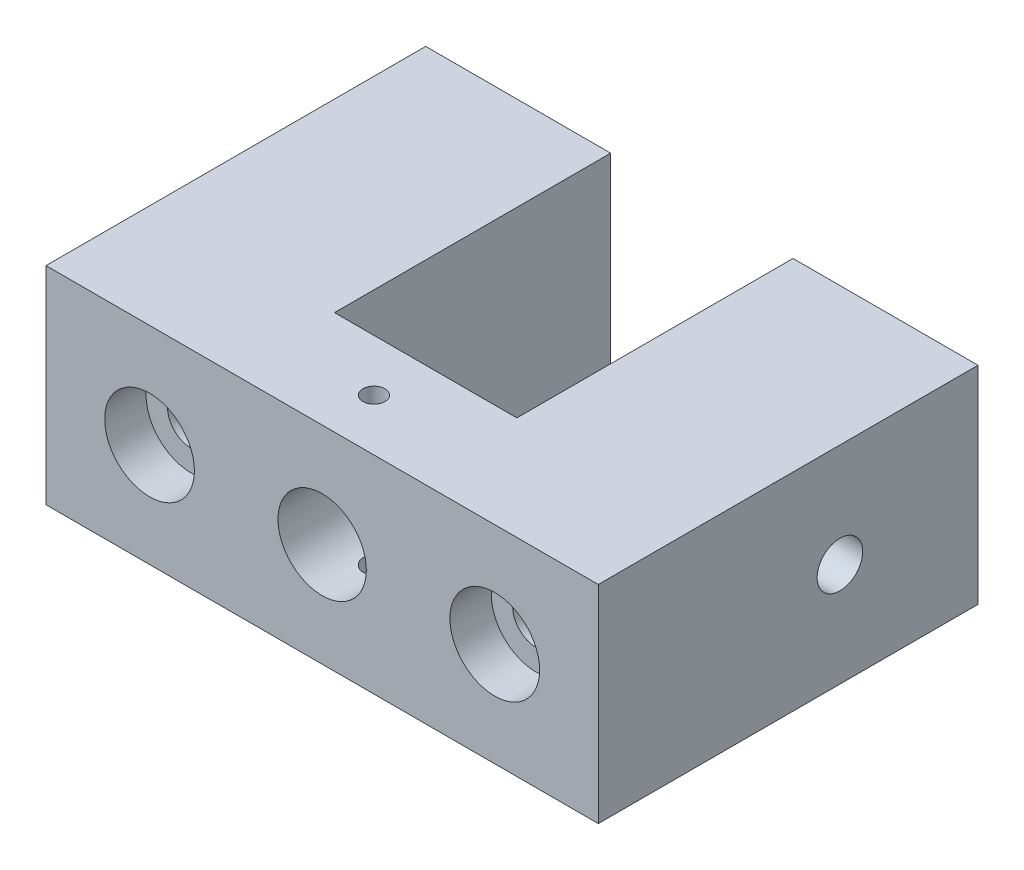
from build123d import *

# Parameters (mm, degrees)
BOSS_EXTRUDE1_DEPTH                 = 7.5
CBORE_FOR_M3_SHCS1_D                = 3.4
CBORE_FOR_M3_SHCS1_CBORE_D          = 6.5
CBORE_FOR_M3_SHCS1_CBORE_DEPTH      = 3
M6_CLEARANCE_HOLE1_D                = 6.4
TAP_DRILL_FOR_M2X0_4_TAP1_D         = 1.6
TAP_START                           = 6.604
TAP_DRILL_FOR_M4X0_7_TAP1_OUTLINE_R = 1.65
TAP_DRILL_FOR_M4X0_7_TAP1_DEPTH     = 13.396


# Read off the part's stored shape, not the designer's step: Tap Drill for M4x0.7 Tap1
with BuildPart() as part:
    # Sketch1 → Boss-Extrude1 (new, symmetric)
    with BuildSketch(Plane(origin=(0, 0, 0), x_dir=(1, 0, 0), z_dir=(0, 1, 0))):
        Polygon((-6.604, 0), (6.604, 0), (6.604, 20), (20, 20), (20, -7.5), (-20, -7.5), (-20, 20), (-6.604, 20), align=None)
    extrude(amount=BOSS_EXTRUDE1_DEPTH, both=True)

    # CBORE for M3 SHCS1 (through all)
    with Locations(Plane.XY.offset(7.5)):
        with Locations((-12.5, 0), (12.5, 0)):
            CounterBoreHole(CBORE_FOR_M3_SHCS1_D / 2, CBORE_FOR_M3_SHCS1_CBORE_D / 2, CBORE_FOR_M3_SHCS1_CBORE_DEPTH)

    # M6 Clearance Hole1 (through all)
    with Locations(Plane.XY.offset(7.5)):
        with Locations((0, 0)):
            Hole(M6_CLEARANCE_HOLE1_D / 2)

    # Tap Drill for M2x0.4 Tap1 (through all)
    with Locations(Plane(origin=(0, 7.5, 0), x_dir=(1, 0, 0), z_dir=(0, 1, 0))):
        with Locations((0, -3.75)):
            Hole(TAP_DRILL_FOR_M2X0_4_TAP1_D / 2)

    # Tap Drill for M4x0.7 Tap1 outline → Tap Drill for M4x0.7 Tap1 (cut)
    with BuildSketch(Plane.YZ.offset(TAP_START)):
        with Locations((0, -10)):
            Circle(TAP_DRILL_FOR_M4X0_7_TAP1_OUTLINE_R)
    extrude(amount=TAP_DRILL_FOR_M4X0_7_TAP1_DEPTH, mode=Mode.SUBTRACT)


solid = part.part
